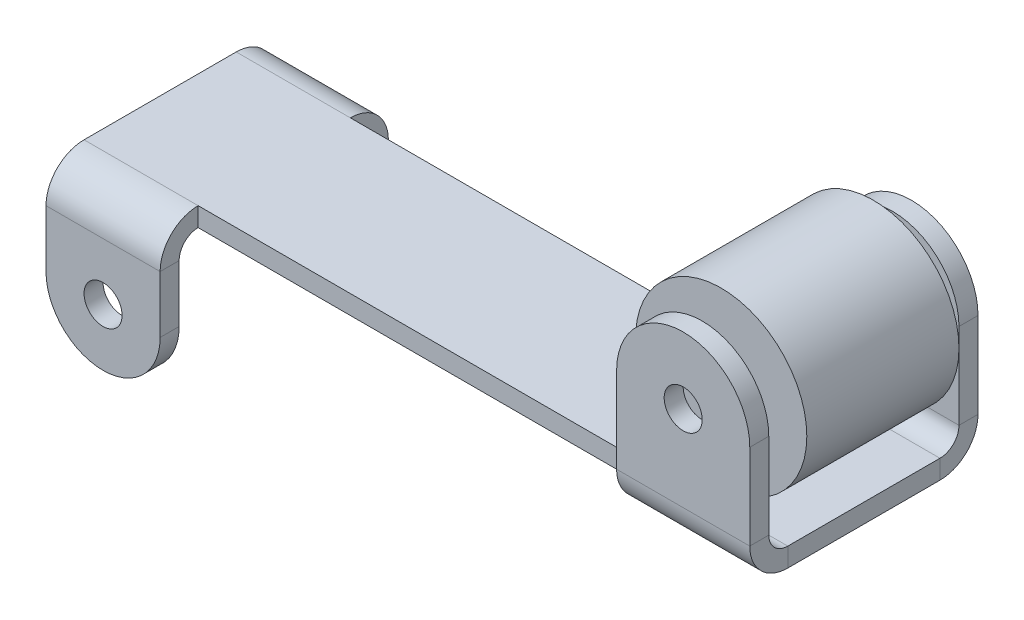
from build123d import *

# Parameters (mm, degrees)
ESQUISSE1_W                        = 18.5
ESQUISSE1_H                        = 0.5
T_LE_DE_BASE_PLI_E1_DEPTH          = 2
T_LE_PLI_E_SUR_AR_TE1_DEPTH        = 3.5
T_LE_START                         = 0.5
T_LE_PLI_E_SUR_AR_TE1_PROFILE_R    = 0.5
T_LE_PLI_E_SUR_AR_TE1_FLAT_DEPTH   = 0.5
T_LE_PLI_E_SUR_AR_TE1_BEND_DEPTH   = 3.5
T_LE_PLI_E_SUR_AR_TE1_PROFILE_2_R  = 0.5
T_LE_PLI_E_SUR_AR_TE1_FLAT_2_DEPTH = 0.5
ESQUISSE12_R                       = 2.25
BOSS_EXTRU_1_DEPTH                 = 2
T_LE_PLI_E_SUR_AR_TE2_DEPTH        = 3
T_LE_PLI_E_SUR_AR_TE2_PROFILE_R    = 0.5
T_LE_PLI_E_SUR_AR_TE2_FLAT_DEPTH   = 0.5
T_LE_PLI_E_SUR_AR_TE2_BEND_DEPTH   = 3
T_LE_PLI_E_SUR_AR_TE2_PROFILE_2_R  = 0.5
T_LE_PLI_E_SUR_AR_TE2_FLAT_2_DEPTH = 0.5


# Sheet-metal steps are written as plain solids
with BuildPart() as part:
    # Esquisse1 → Tôle de base pliée1 (new, symmetric)
    with BuildSketch(Plane.XY):
        with Locations((9.25, -0.25)):
            Rectangle(ESQUISSE1_W, ESQUISSE1_H)
    extrude(amount=T_LE_DE_BASE_PLI_E1_DEPTH, both=True)

    # Tôle pliée sur arête1 bend section (across the edge) → Tôle pliée sur arête1 (add)
    with BuildSketch(Plane(origin=(15, 0, 2.5), x_dir=(0, 0, -1), z_dir=(1, 0, 0))):
        with BuildLine():
            Line((-0.5, 0.5), (0, 0.5))
            ThreePointArc((0, 0.5), (0.146446609, 0.146446609), (0.5, 0))
            Line((0.5, 0), (0.5, -0.5))
            ThreePointArc((0.5, -0.5), (-0.207106781, -0.207106781), (-0.5, 0.5))
        make_face()
    extrude(amount=T_LE_PLI_E_SUR_AR_TE1_DEPTH)

    # Tôle pliée sur arête1 profile (on flange) → Tôle pliée sur arête1 flat (add)
    with BuildSketch(Plane.XY.offset(2.5).offset(T_LE_START)):
        with BuildLine():
            Line((15, 0.5), (18.5, 0.5))
            Line((18.5, 0.5), (18.5, 2.75))
            ThreePointArc((18.5, 2.75), (16.75, 4.5), (15, 2.75))
            Line((15, 2.75), (15, 0.5))
        make_face()
        with Locations((16.75, 2.75)):
            Circle(T_LE_PLI_E_SUR_AR_TE1_PROFILE_R, mode=Mode.SUBTRACT)
    extrude(amount=-T_LE_PLI_E_SUR_AR_TE1_FLAT_DEPTH)

    # Tôle pliée sur arête1 bend section 2 (across the edge) → Tôle pliée sur arête1 bend (add)
    with BuildSketch(Plane(origin=(18.5, 0, -2.5), x_dir=(0, 0, 1), z_dir=(-1, 0, 0))):
        with BuildLine():
            Line((-0.5, 0.5), (0, 0.5))
            ThreePointArc((0, 0.5), (0.146446609, 0.146446609), (0.5, 0))
            Line((0.5, 0), (0.5, -0.5))
            ThreePointArc((0.5, -0.5), (-0.207106781, -0.207106781), (-0.5, 0.5))
        make_face()
    extrude(amount=T_LE_PLI_E_SUR_AR_TE1_BEND_DEPTH)

    # Tôle pliée sur arête1 profile 2 (on flange) → Tôle pliée sur arête1 flat 2 (add)
    with BuildSketch(Plane(origin=(0, 0, -2.5), x_dir=(-1, 0, 0), z_dir=(0, 0, -1)).offset(T_LE_START)):
        with BuildLine():
            Line((-18.5, 2.75), (-18.5, 0.5))
            Line((-18.5, 0.5), (-15, 0.5))
            Line((-15, 0.5), (-15, 2.75))
            ThreePointArc((-15, 2.75), (-16.75, 4.5), (-18.5, 2.75))
        make_face()
        with Locations((-16.75, 2.75)):
            Circle(T_LE_PLI_E_SUR_AR_TE1_PROFILE_2_R, mode=Mode.SUBTRACT)
    extrude(amount=-T_LE_PLI_E_SUR_AR_TE1_FLAT_2_DEPTH)

    # Tôle pliée sur arête2 bend section (across the edge) → Tôle pliée sur arête2 (add)
    with BuildSketch(Plane(origin=(3, -0.5, 2.5), x_dir=(0, 0, -1), z_dir=(-1, 0, 0))):
        with BuildLine():
            Line((-0.5, 0.5), (0, 0.5))
            ThreePointArc((0, 0.5), (0.146446609, 0.146446609), (0.5, 0))
            Line((0.5, 0), (0.5, -0.5))
            ThreePointArc((0.5, -0.5), (-0.207106781, -0.207106781), (-0.5, 0.5))
        make_face()
    extrude(amount=T_LE_PLI_E_SUR_AR_TE2_DEPTH)

    # Tôle pliée sur arête2 profile (on flange) → Tôle pliée sur arête2 flat (add)
    with BuildSketch(Plane(origin=(0, -0.5, 2.5), x_dir=(-1, 0, 0), z_dir=(0, 0, 1)).offset(T_LE_START)):
        with BuildLine():
            ThreePointArc((0, 2), (-1.5, 3.5), (-3, 2))
            Line((-3, 2), (-3, 0.5))
            Line((-3, 0.5), (0, 0.5))
            Line((0, 0.5), (0, 2))
        make_face()
        with Locations((-1.5, 2)):
            Circle(T_LE_PLI_E_SUR_AR_TE2_PROFILE_R, mode=Mode.SUBTRACT)
    extrude(amount=-T_LE_PLI_E_SUR_AR_TE2_FLAT_DEPTH)

    # Tôle pliée sur arête2 bend section 2 (across the edge) → Tôle pliée sur arête2 bend (add)
    with BuildSketch(Plane(origin=(0, -0.5, -2.5), x_dir=(0, 0, 1), z_dir=(1, 0, 0))):
        with BuildLine():
            Line((-0.5, 0.5), (0, 0.5))
            ThreePointArc((0, 0.5), (0.146446609, 0.146446609), (0.5, 0))
            Line((0.5, 0), (0.5, -0.5))
            ThreePointArc((0.5, -0.5), (-0.207106781, -0.207106781), (-0.5, 0.5))
        make_face()
    extrude(amount=T_LE_PLI_E_SUR_AR_TE2_BEND_DEPTH)

    # Tôle pliée sur arête2 profile 2 (on flange) → Tôle pliée sur arête2 flat 2 (add)
    with BuildSketch(Plane(origin=(0, -0.5, -2.5), x_dir=(1, 0, 0), z_dir=(0, 0, -1)).offset(T_LE_START)):
        with BuildLine():
            ThreePointArc((3, 2), (1.5, 3.5), (0, 2))
            Line((0, 2), (0, 0.5))
            Line((0, 0.5), (3, 0.5))
            Line((3, 0.5), (3, 2))
        make_face()
        with Locations((1.5, 2)):
            Circle(T_LE_PLI_E_SUR_AR_TE2_PROFILE_2_R, mode=Mode.SUBTRACT)
    extrude(amount=-T_LE_PLI_E_SUR_AR_TE2_FLAT_2_DEPTH)


with BuildPart() as body_2:
    # Esquisse12 → Boss.-Extru.1 (new, symmetric)
    with BuildSketch(Plane.XY):
        with Locations((16.75, 2.75)):
            Circle(ESQUISSE12_R)
    extrude(amount=BOSS_EXTRU_1_DEPTH, both=True)


solid = Compound([part.part, body_2.part])
